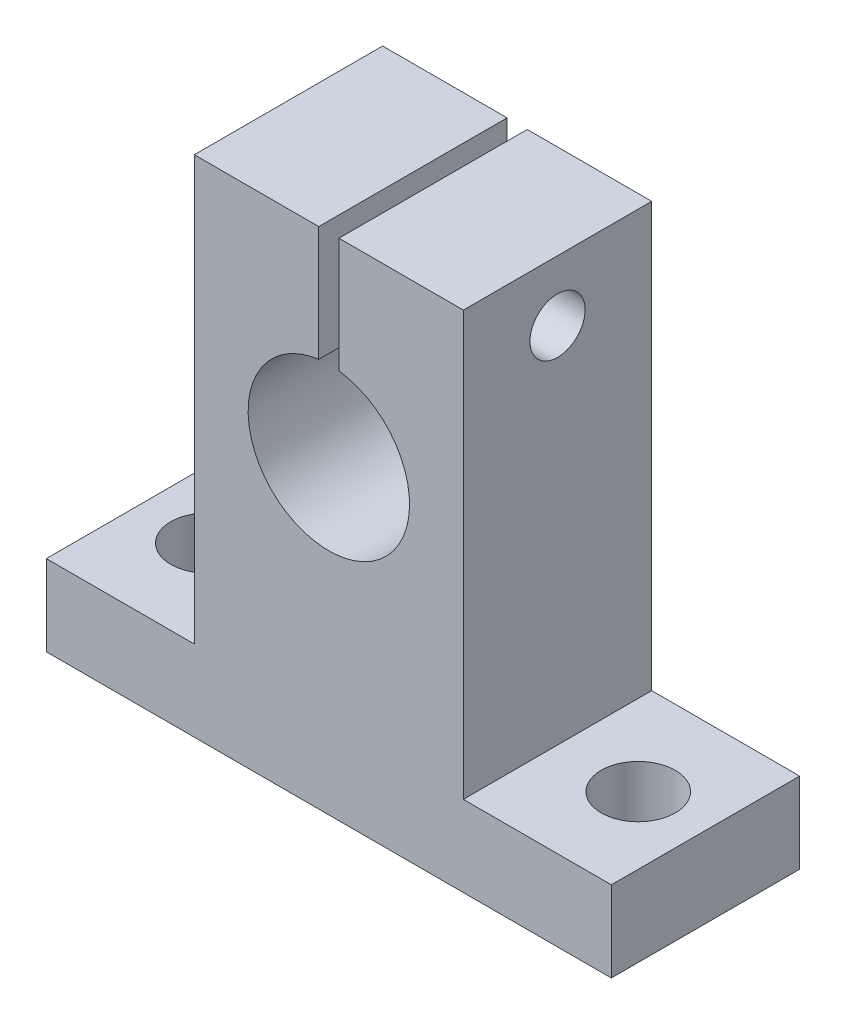
from build123d import *

# Parameters (mm, degrees)
BOSS_EXTRUDE1_DEPTH = 7
SKETCH2_R           = 6
CUT_EXTRUDE1_DEPTH  = 46.202322949
SKETCH3_R           = 2.05
CUT_EXTRUDE2_DEPTH  = 50.155365933
SKETCH4_R           = 2.75
CUT_EXTRUDE3_DEPTH  = 14
SKETCH5_W           = 1.5
SKETCH5_H           = 29
CUT_EXTRUDE4_DEPTH  = 46.202322949


with BuildPart() as part:
    # Sketch1 → Boss-Extrude1 (new, symmetric)
    with BuildSketch(Plane.XY):
        Polygon((0, 0), (21, 0), (21, 6), (10, 6), (10, 37.5), (0, 37.5), align=None)
    boss_extrude1 = extrude(amount=BOSS_EXTRUDE1_DEPTH, both=True)

    # Mirror1: Boss-Extrude1 across plane
    add(boss_extrude1.mirror(Plane(origin=(0, 37.5, 7), x_dir=(0, 0, 1), z_dir=(1, 0, 0))))

    # Sketch2 → Cut-Extrude1 (cut, through all)
    with BuildSketch(Plane.XY.offset(7)):
        with Locations((0, 23)):
            Circle(SKETCH2_R)
    extrude(amount=-CUT_EXTRUDE1_DEPTH, mode=Mode.SUBTRACT)

    # Sketch3 → Cut-Extrude2 (cut, through all)
    with BuildSketch(Plane(origin=(10, 0, 0), x_dir=(0, 0, -1), z_dir=(1, 0, 0))):
        with Locations((0, 33)):
            Circle(SKETCH3_R)
    extrude(amount=-CUT_EXTRUDE2_DEPTH, mode=Mode.SUBTRACT)

    # Sketch4 → Cut-Extrude3 (cut)
    with BuildSketch(Plane(origin=(0, 6, 0), x_dir=(1, 0, 0), z_dir=(0, 1, 0))):
        with Locations((-16, 0)):
            Circle(SKETCH4_R)
        with Locations((16, 0)):
            Circle(SKETCH4_R)
    extrude(amount=-CUT_EXTRUDE3_DEPTH, mode=Mode.SUBTRACT)

    # Sketch5 → Cut-Extrude4 (cut, through all)
    with BuildSketch(Plane.XY.offset(7)):
        with Locations((0, 37.5)):
            Rectangle(SKETCH5_W, SKETCH5_H)
    extrude(amount=-CUT_EXTRUDE4_DEPTH, mode=Mode.SUBTRACT)


solid = part.part
